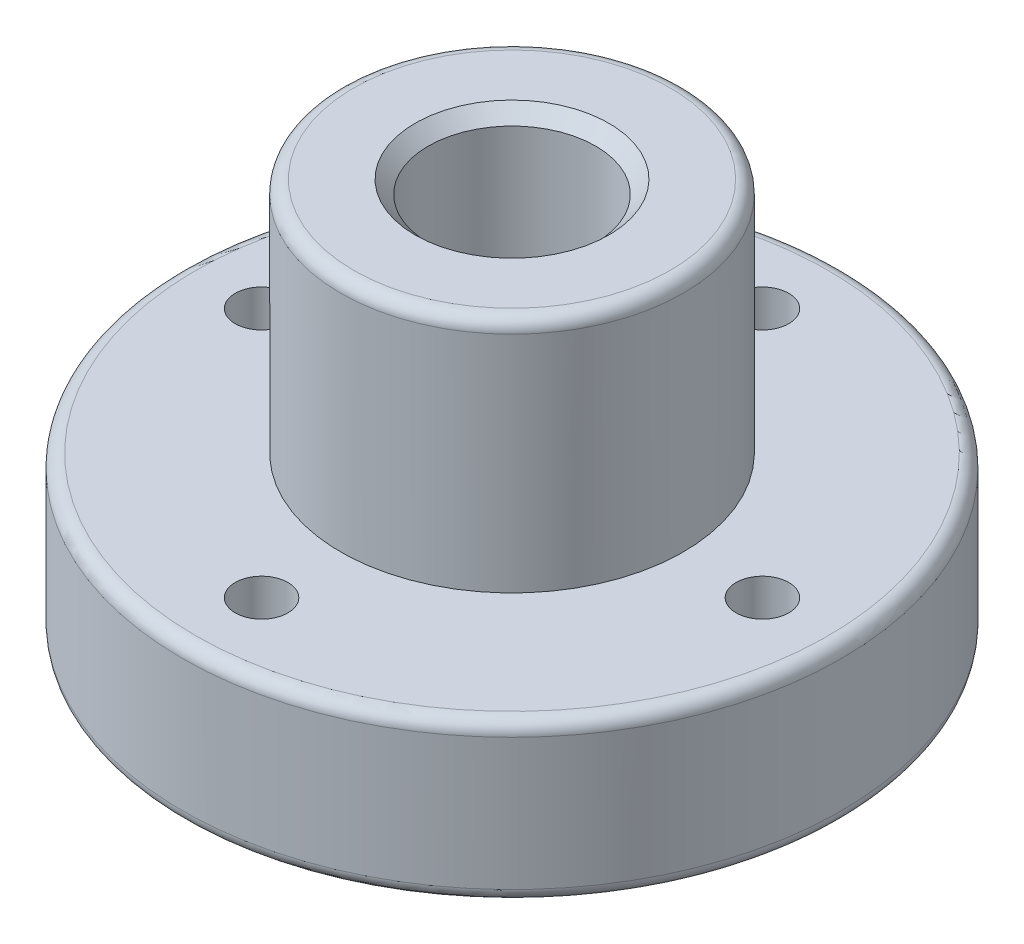
from build123d import *

# Parameters (mm, degrees)
ESQUISSE3_R             = 1
ENL_V_MAT_EXTRU_1_DEPTH = 20.836834425
CONG_1_R                = 0.5
CHANFREIN1_SIZE         = 0.5


with BuildPart() as part:
    # Esquisse1 → Révolution2 (revolve)
    with BuildSketch(Plane.XY):
        Polygon((6.5, 15), (6.5, 6), (12.5, 6), (12.5, 0), (3.175, 0), (3.175, 15), align=None)
    revolve(axis=Axis((0, 0, 0), (0, 1, 0)))

    # Esquisse3 → Enlèv. mat.-Extru.1 (cut, through all)
    with BuildSketch(Plane(origin=(0, 6, 0), x_dir=(1, 0, 0), z_dir=(0, 1, 0))):
        with Locations((9.5, 0)):
            Circle(ESQUISSE3_R)
        with Locations((0, -9.5)):
            Circle(ESQUISSE3_R)
        with Locations((-9.5, 0)):
            Circle(ESQUISSE3_R)
        with Locations((0, 9.5)):
            Circle(ESQUISSE3_R)
    extrude(amount=-ENL_V_MAT_EXTRU_1_DEPTH, mode=Mode.SUBTRACT)

    # Congé1
    cong_1_edges = [part.edges().sort_by_distance(p)[0] for p in [
        (-6.5, 15, 0),
        (-12.5, 0, 0),
        (-12.5, 6, 0),
    ]]
    fillet(cong_1_edges, radius=CONG_1_R)

    # Chanfrein1
    chanfrein1_edges = [part.edges().sort_by_distance(p)[0] for p in [
        (-3.175, 0, 0),
        (-3.175, 15, 0),
    ]]
    chamfer(chanfrein1_edges, length=CHANFREIN1_SIZE)


solid = part.part
